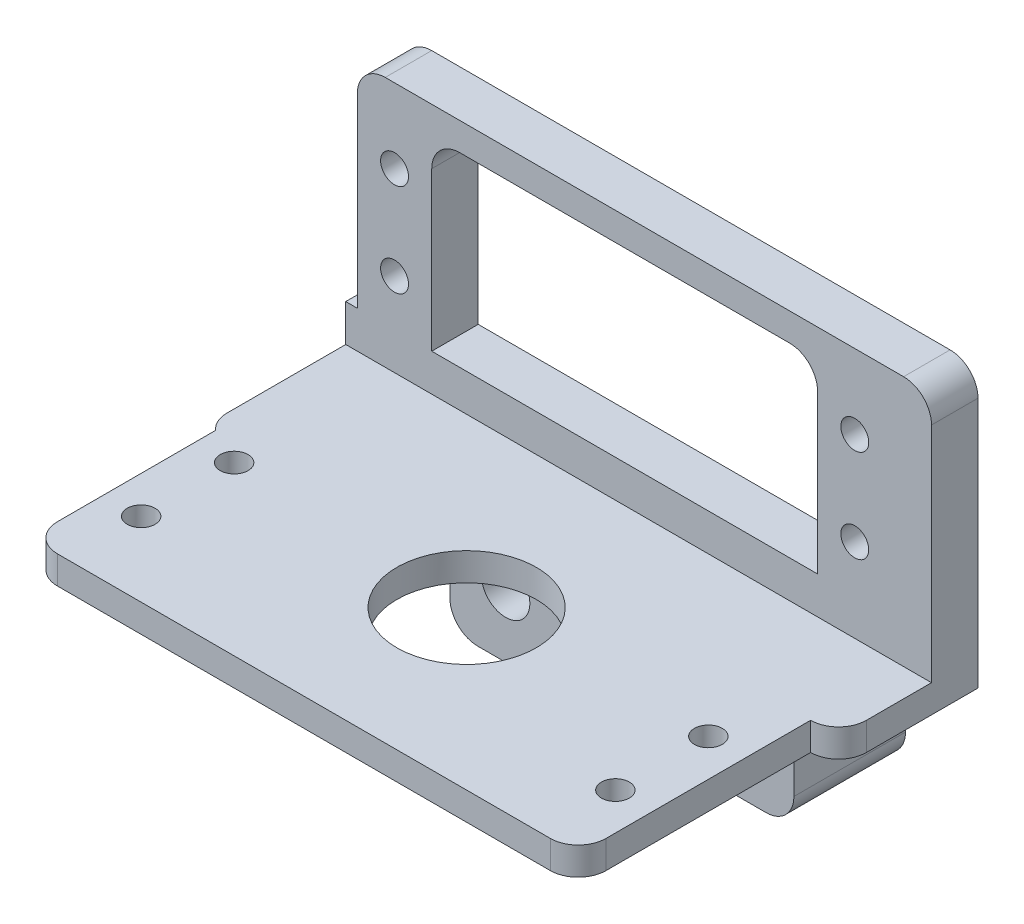
from build123d import *

# Parameters (mm, degrees)
SKETCH_1_W           = 60
SKETCH_1_H           = 5
EXTRUDE_1_DEPTH      = 7
SKETCH_2_W           = 8
SKETCH_2_H           = 5
EXTRUDE_2_DEPTH      = 20
SKETCH_3_R           = 1.5
CUT_EXTRUDE_1_DEPTH  = 15
SKETCH_6_W           = 60
SKETCH_6_H           = 3
EXTRUDE_3_DEPTH      = 35
SKETCH_7_W           = 1
SKETCH_7_H           = 20
CUT_EXTRUDE_2_DEPTH  = 40
SKETCH_8_R           = 1.5
SKETCH_8_R_2         = 7.5
CUT_EXTRUDE_3_DEPTH  = 10
EXTRUDE_4_DEPTH      = 3
EXTRUDE_4_DEPTH_BACK = 9
SKETCH_9_W           = 12
SKETCH_9_H           = 14
SKETCH_9_R           = 2.5
FILLET_3_R           = 3
SKETCH_12_W          = 57.5
SKETCH_12_H          = 5
EXTRUDE_6_DEPTH      = 3
FILLET_6_R           = 3
FILLET_7_R           = 1.5
FILLET_8_R           = 5
FILLET_9_R           = 3
FILLET_10_R          = 3
SKETCH_14_W          = 1.25
SKETCH_14_H          = 5
EXTRUDE_7_DEPTH      = 23
EXTRUDE_8_DEPTH      = 3
FILLET_12_R          = 3
SKETCH_17_R          = 2.6
CUT_EXTRUDE_4_DEPTH  = 15


# Some blends are built 0.0001 mm under size
with BuildPart() as part:
    # 草图1 → 凸台-拉伸1 (new body)
    with BuildSketch(Plane(origin=(0, 0, 0), x_dir=(1, 0, 0), z_dir=(0, 1, 0))):
        Rectangle(SKETCH_1_W, SKETCH_1_H)
    extrude(amount=EXTRUDE_1_DEPTH)

    # 草图2 → 凸台-拉伸2 (add)
    with BuildSketch(Plane(origin=(0, 7, 0), x_dir=(1, 0, 0), z_dir=(0, 1, 0))):
        with Locations((24.75, 0)):
            Rectangle(SKETCH_2_W, SKETCH_2_H)
        with Locations((-24.75, 0)):
            Rectangle(SKETCH_2_W, SKETCH_2_H)
    extrude(amount=EXTRUDE_2_DEPTH)

    # 草图3 → 切除-拉伸1 (cut)
    with BuildSketch(Plane(origin=(0, 0, -2.5), x_dir=(-1, 0, 0), z_dir=(0, 0, -1))):
        with Locations((-24.75, 22)):
            Circle(SKETCH_3_R)
        with Locations((-24.75, 12)):
            Circle(SKETCH_3_R)
        with Locations((24.75, 12)):
            Circle(SKETCH_3_R)
        with Locations((24.75, 22)):
            Circle(SKETCH_3_R)
    extrude(amount=-CUT_EXTRUDE_1_DEPTH, mode=Mode.SUBTRACT)

    # 草图6 → 凸台-拉伸3 (add)
    with BuildSketch(Plane.XY.offset(2.5)):
        with Locations((0, 1.5)):
            Rectangle(SKETCH_6_W, SKETCH_6_H)
    extrude(amount=EXTRUDE_3_DEPTH)

    # 草图7 → 切除-拉伸2 (cut)
    with BuildSketch(Plane(origin=(0, 3, 0), x_dir=(1, 0, 0), z_dir=(0, 1, 0))):
        with Locations((-29.5, -27.5)):
            Rectangle(SKETCH_7_W, SKETCH_7_H)
    extrude(amount=-CUT_EXTRUDE_2_DEPTH, mode=Mode.SUBTRACT)

    # 草图8 → 切除-拉伸3 (cut)
    with BuildSketch(Plane(origin=(0, 3, 0), x_dir=(1, 0, 0), z_dir=(0, 1, 0))):
        with Locations(Location((-25, -19.5, 0), (0, 0, 270))):
            Circle(SKETCH_8_R)
        with Locations(Location((-25, -29.5, 0), (0, 0, 270))):
            Circle(SKETCH_8_R)
        with Locations(Location((26, -29.5, 0), (0, 0, 270))):
            Circle(SKETCH_8_R)
        with Locations(Location((26, -19.5, 0), (0, 0, 270))):
            Circle(SKETCH_8_R)
        with Locations(Location((1, -20.5, 0), (0, 0, 270))):
            Circle(SKETCH_8_R_2)
    extrude(amount=-CUT_EXTRUDE_3_DEPTH, mode=Mode.SUBTRACT)

    # 草图9 → 凸台-拉伸4 (add, two sides: drawn at the far end of the back side and taken through both)
    # profile 1 of 2: a face of its own
    with BuildSketch(Plane(origin=(0, 0, -2.5), x_dir=(-1, 0, 0), z_dir=(0, 0, -1)).offset(-EXTRUDE_4_DEPTH_BACK)):
        with Locations((-16.2, -7)):
            Rectangle(SKETCH_9_W, SKETCH_9_H)
        with Locations((-16.2, -7.219000805)):
            Circle(SKETCH_9_R, mode=Mode.SUBTRACT)
    # profile 2 of 2: a face of its own
    with BuildSketch(Plane(origin=(0, 0, -2.5), x_dir=(-1, 0, 0), z_dir=(0, 0, -1)).offset(-EXTRUDE_4_DEPTH_BACK)):
        with Locations((8.8, -7)):
            Rectangle(SKETCH_9_W, SKETCH_9_H)
        with Locations((8.8, -7.219000805)):
            Circle(SKETCH_9_R, mode=Mode.SUBTRACT)
    extrude(amount=EXTRUDE_4_DEPTH + EXTRUDE_4_DEPTH_BACK)

    # 圆角3
    # the kernel refuses this fillet: 3 mm, written as the material it takes off along each edge
    with BuildSketch(Plane(origin=(-30, 8.590169944, 17.5), x_dir=(0, 0, -1), z_dir=(0, -1, 0))) as fillet_3_piece_1:
        with BuildLine():
            CenterArc((2.236067977, 3), FILLET_3_R, 221.810314896, 48.189685104)
            Line((0, 1), (-0.04472136, 0.96))
            ThreePointArc((-0.04472136, 0.96), (-0.06, 0.5), (-0.06, 0))
            Line((-0.06, 0), (0, -0.06))
            Line((0, -0.06), (2.236067977, -0.06))
            Line((2.236067977, -0.06), (2.236067977, 0))
        make_face()
    extrude(amount=14.180339887, mode=Mode.SUBTRACT)

    # 草图12 → 凸台-拉伸6 (add)
    with BuildSketch(Plane(origin=(0, 27, 0), x_dir=(1, 0, 0), z_dir=(0, 1, 0))):
        Rectangle(SKETCH_12_W, SKETCH_12_H)
    extrude(amount=EXTRUDE_6_DEPTH)

    # 圆角6
    fillet_6_edges = [part.edges().sort_by_distance(p)[0] for p in [
        (-28.75, 30, 0),
        (20.75, 27, 0),
        (-20.75, 27, 0),
    ]]
    fillet(fillet_6_edges, radius=FILLET_6_R)

    # 圆角7
    fillet_7_edges = [part.edges().sort_by_distance(p)[0] for p in [
        (16.2, 0, -2.5),
        (-8.8, 0, -2.5),
    ]]
    fillet(fillet_7_edges, radius=FILLET_7_R)
    fillet_7_2_edges = [part.edges().sort_by_distance(p)[0] for p in [
        (-8.8, 0, -5.5),
        (16.2, 0, -5.5),
    ]]
    fillet(fillet_7_2_edges, radius=FILLET_7_R - 0.0001)  # a hair under: the kernel refuses the full size

    # 圆角8
    fillet_8_edges = [part.edges().sort_by_distance(p)[0] for p in [
        (22.2, 0, 2),
        (10.2, 0, 2),
        (-2.8, 0, 2),
        (-14.8, 0, 2),
    ]]
    fillet(fillet_8_edges, radius=FILLET_8_R)

    # 圆角9
    fillet_9_edges = [part.edges().sort_by_distance(p)[0] for p in [
        (22.2, -14, 0.5),
        (10.2, -14, 0.5),
        (-14.8, -14, 0.5),
        (-2.8, -14, 0.5),
    ]]
    fillet(fillet_9_edges, radius=FILLET_9_R)

    # 圆角10
    fillet_10_edges = [part.edges().sort_by_distance(p)[0] for p in [
        (30, 1.5, 37.5),
        (-29, 1.5, 37.5),
    ]]
    fillet(fillet_10_edges, radius=FILLET_10_R)

    # 草图14 → 凸台-拉伸7 (add)
    with BuildSketch(Plane(origin=(0, 7, 0), x_dir=(1, 0, 0), z_dir=(0, 1, 0))):
        with Locations((29.375, 0)):
            Rectangle(SKETCH_14_W, SKETCH_14_H)
    extrude(amount=EXTRUDE_7_DEPTH)

    # 草图16 → 凸台-拉伸8 (add)
    with BuildSketch(Plane(origin=(30, 0, 0), x_dir=(0, 0, -1), z_dir=(1, 0, 0))):
        Polygon((-12.5, 0), (-12.5, 3), (-2.5, 3), (-2.5, 30), (2.5, 30), (2.5, 0), align=None)
    extrude(amount=EXTRUDE_8_DEPTH)

    # 圆角12
    fillet_12_edges = [part.edges().sort_by_distance(p)[0] for p in [
        (33, 1.5, 12.5),
        (33, 30, 0),
    ]]
    fillet(fillet_12_edges, radius=FILLET_12_R - 0.0001)  # a hair under: the kernel refuses the full size

    # 草图17 → 切除-拉伸4 (cut)
    with BuildSketch(Plane(origin=(0, 0, -5.5), x_dir=(-1, 0, 0), z_dir=(0, 0, -1))):
        with Locations((-16.2, -7.219000805)):
            Circle(SKETCH_17_R)
        with Locations((8.8, -7.219000805)):
            Circle(SKETCH_17_R)
    extrude(amount=-CUT_EXTRUDE_4_DEPTH, mode=Mode.SUBTRACT)


solid = part.part
